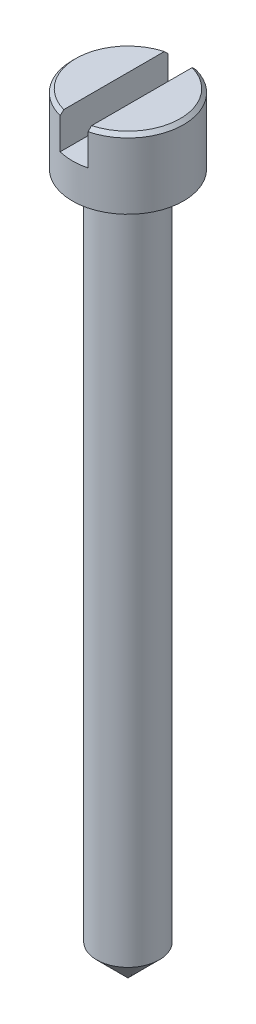
from build123d import *

# Parameters (mm, degrees)
CHAMFER_1_SIZE           = 9
CUT_EXTRUDE_1_DEPTH      = 223.652756552
CUT_EXTRUDE_1_DEPTH_BACK = 223.652756552
SKETCH_2_W               = 8
SKETCH_2_H               = 10
CHAMFER_2_SIZE           = 1


with BuildPart() as part:
    # Эскиз1 → Повернуть1 (revolve)
    with BuildSketch(Plane.XY, mode=Mode.PRIVATE) as revolve_1_sk:
        Polygon((0, 0), (0, 221.5), (16, 221.5), (16, 201.5), (9, 201.5), (9, 0), align=None)
    revolve(revolve_1_sk.sketch.rotate(Axis((0, 0, 0), (0, -1, 0)), 90), axis=Axis((0, 0, 0), (0, -1, 0)))

    # Фаска1
    chamfer_1_edges = [part.edges().sort_by_distance(p)[0] for p in [
        (0, 0, -9),
    ]]
    chamfer(chamfer_1_edges, length=CHAMFER_1_SIZE - 0.0001)  # a hair under: the kernel refuses the full size

    # Эскиз2 → Вырез-Вытянуть1 (cut, two sides: drawn at the far end of the back side and taken through both)
    with BuildSketch(Plane.XY.offset(-CUT_EXTRUDE_1_DEPTH_BACK)):
        with Locations((0, 216.5)):
            Rectangle(SKETCH_2_W, SKETCH_2_H)
    extrude(amount=CUT_EXTRUDE_1_DEPTH + CUT_EXTRUDE_1_DEPTH_BACK, mode=Mode.SUBTRACT)

    # Фаска2
    chamfer_2_edges = [part.edges().sort_by_distance(p)[0] for p in [
        (16, 221.5, 0),
        (-16, 221.5, 0),
    ]]
    chamfer(chamfer_2_edges, length=CHAMFER_2_SIZE)


solid = part.part
